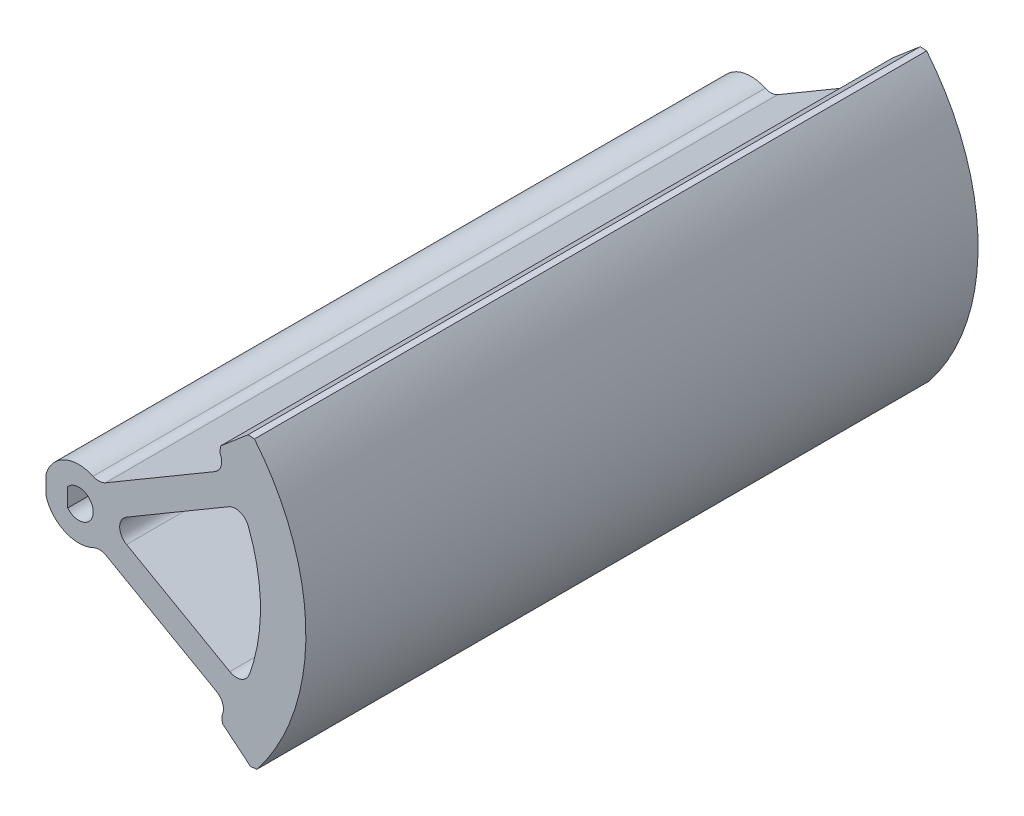
from build123d import *
from build123d.topology import SkipClean

# Parameters (mm, degrees)
BOSS_EXTRUDE1_DEPTH     = 74
CHAMFER1_SIZE           = 1
FILLET1_R               = 3
CUT_EXTRUDE1_DEPTH      = 121.138628729
CUT_EXTRUDE1_DEPTH_BACK = 121.138628729
CUT_EXTRUDE2_REACH      = 111.646
SKETCH4_R               = 1


with BuildPart() as part:
    # Sketch1 → Boss-Extrude1 (new, symmetric)
    with BuildSketch(Plane.XY):
        with BuildLine():
            Line((55.830466766, 51.361253738), (63.438083445, 57.851567172))
            ThreePointArc((63.438083445, 57.851567172), (72.243195979, 42.88470747), (75.398327752, 25.808934001))
            Line((75.398327752, 25.808934001), (65.398662212, 25.727147202))
            ThreePointArc((65.398662212, 25.727147202), (64.324262485, 34.614216947), (61.300381376, 43.039802177))
            Line((61.300381376, 43.039802177), (31.399799374, 25.449072083))
            Line((31.399799374, 25.449072083), (26.399966604, 25.408178684))
            ThreePointArc((26.399966604, 25.408178684), (25.395910676, 26.399991642), (24.40000005, 25.400000004))
            ThreePointArc((24.40000005, 25.400000004), (24.411675325, 25.24763781), (24.446428526, 25.098833357))
            Line((24.446428526, 25.098833357), (18.248213622, 23.141250154))
            ThreePointArc((18.248213622, 23.141250154), (17.987564613, 24.25728355), (17.90000005, 25.400000004))
            ThreePointArc((17.90000005, 25.400000004), (21.992343112, 32.081158151), (29.803433168, 31.471225314))
            Line((29.803433168, 31.471225314), (58.257984046, 48.211244769))
            ThreePointArc((58.257984046, 48.211244769), (57.083396924, 49.816436323), (55.830466766, 51.361253738))
        make_face()
    boss_extrude1 = extrude(amount=BOSS_EXTRUDE1_DEPTH, both=True)

    # Mirror1: Boss-Extrude1 across plane
    with SkipClean():  # the faces are left unmerged after this step: merging them gives an invalid solid
        add(boss_extrude1.mirror(Plane(origin=(-0.206032496, 25.190569454, 0), x_dir=(0, 0, 1), z_dir=(0.008178679945042752, -0.9999665540378622, 0))))

    # Chamfer1
    # the kernel refuses this chamfer: 1 mm, written as the material it takes off along each edge
    with BuildSketch(Plane(origin=(55.830466766, 51.361253738, -76.604800739), x_dir=(0.7607616678932755, 0.6490313433604278, 0), z_dir=(0, 0, 1))) as chamfer1_piece_1:
        with BuildLine():
            Line((CHAMFER1_SIZE, 0), (-0.01282473, -1.01282473))
            ThreePointArc((-0.01282473, -1.01282473), (-0.003390265, -0.520777989), (0, 0))
            Line((0, 0), (CHAMFER1_SIZE, 0))
        make_face()
    extrude(amount=153.209601479, mode=Mode.SUBTRACT)
    with BuildSketch(Plane(origin=(63.438083445, 57.851567172, 76.571682988), x_dir=(-0.7607616678932776, -0.6490313433604255, 0), z_dir=(0, 0, -1))) as chamfer1_piece_2:
        with BuildLine():
            Line((CHAMFER1_SIZE, 0), (0.009805807, -0.990194193))
            ThreePointArc((0.009805807, -0.990194193), (0.002592086, -0.509118755), (0, 0))
            Line((0, 0), (CHAMFER1_SIZE, 0))
        make_face()
    extrude(amount=153.143365976, mode=Mode.SUBTRACT)
    with BuildSketch(Plane(origin=(63.963798858, -6.425043932, 76.571682988), x_dir=(0.6288321665267481, 0.7775410640868277, 0), z_dir=(0, 0, -1))) as chamfer1_piece_3:
        with BuildLine():
            Line((0.990242745, 0), (CHAMFER1_SIZE * 0.00990242744899, -CHAMFER1_SIZE * 0.999950969763))
            Line((CHAMFER1_SIZE * 0.00990242744899, -CHAMFER1_SIZE * 0.999950969763), (0, 0))
            ThreePointArc((0, 0), (0.509119461, 0.002449552), (0.990242745, 0))
        make_face()
    extrude(amount=153.143365976, mode=Mode.SUBTRACT)
    with BuildSketch(Plane(origin=(56.251039097, -0.060035145, -76.604800739), x_dir=(0.6266844831673307, 0.7792730962616993, 0), z_dir=(0, 0, 1))) as chamfer1_piece_4:
        with BuildLine():
            Line((1.012905922, 0), (-CHAMFER1_SIZE * 0.0126613240298, -CHAMFER1_SIZE * 0.999919842224))
            Line((-CHAMFER1_SIZE * 0.0126613240298, -CHAMFER1_SIZE * 0.999919842224), (0, 0))
            ThreePointArc((0, 0), (0.520779169, -0.003203746), (1.012905922, 0))
        make_face()
    extrude(amount=153.209601479, mode=Mode.SUBTRACT)

    # Fillet1
    # the kernel refuses this fillet: 3 mm, written as the material it adds along each edge
    with BuildSketch(Plane(origin=(61.300381376, 43.039802177, 74), x_dir=(-0.8619070987590498, -0.5070662216207636, 0), z_dir=(0, 0, -1))) as fillet1_piece_1:
        with BuildLine():
            CenterArc((3.377068823, -3), FILLET1_R, 90, 99.332418184)
            Line((0.416776456, -3.486486486), (0.357570609, -3.496216216))
            ThreePointArc((0.357570609, -3.496216216), (0.110537283, -1.754940397), (-0.059831012, -0.0045))
            Line((-0.059831012, -0.0045), (0, 0.06))
            Line((0, 0.06), (3.377068823, 0.06))
            Line((3.377068823, 0.06), (3.377068823, 0))
        make_face()
    extrude(amount=148)
    with BuildSketch(Plane(origin=(31.399799374, 25.449072083, 74), x_dir=(0.861907098759051, 0.5070662216207618, 0), z_dir=(0, 0, -1))) as fillet1_piece_2:
        with BuildLine():
            CenterArc((FILLET1_R * 1.73205080757, FILLET1_R), FILLET1_R, 150, 120)
            Line((FILLET1_R * 0.866025403784, FILLET1_R * 1.5), (FILLET1_R * 0.848704895709, FILLET1_R * 1.51))
            Line((FILLET1_R * 0.848704895709, FILLET1_R * 1.51), (-FILLET1_R * 0.0346410161514, -FILLET1_R * 0.02))
            Line((-FILLET1_R * 0.0346410161514, -FILLET1_R * 0.02), (FILLET1_R * 1.73205080757, -FILLET1_R * 0.02))
            Line((FILLET1_R * 1.73205080757, -FILLET1_R * 0.02), (FILLET1_R * 1.73205080757, 0))
        make_face()
    extrude(amount=148)
    with BuildSketch(Plane(origin=(29.803433168, 31.471225314, -74), x_dir=(-0.8632427379298097, 0.5047890405025113, 0), z_dir=(0, 0, 1))) as fillet1_piece_3:
        with BuildLine():
            CenterArc((1.767704789, -2.985498375), FILLET1_R, 95.63586305, 55.150095421)
            Line((-0.850702684, -1.521277659), (-0.903070833, -1.491993244))
            Line((-0.903070833, -1.491993244), (-0.052368149, 0.029284414))
            Line((-0.052368149, 0.029284414), (0.005892349, 0.059709968))
            ThreePointArc((0.005892349, 0.059709968), (0.736543662, 0.023745938), (1.467194975, 0.059709968))
            Line((1.467194975, 0.059709968), (1.473087324, 0))
        make_face()
    extrude(amount=148)
    with BuildSketch(Plane(origin=(58.257984046, 48.211244769, -74), x_dir=(-0.6003331349359272, 0.7997500403863709, 0), z_dir=(0, 0, 1))) as fillet1_piece_4:
        with BuildLine():
            CenterArc((3.35394685, 2.974664865), FILLET1_R, 173.574848661, 88.973633867)
            Line((0.372790176, 3.310380343), (0.313167042, 3.317094653))
            Line((0.313167042, 3.317094653), (-0.059623133, 0.00671431))
            Line((-0.059623133, 0.00671431), (-0.002223664, -0.05995878))
            ThreePointArc((-0.002223664, -0.05995878), (1.482442617, -0.087479891), (2.957104003, -0.059493297))
            Line((2.957104003, -0.059493297), (2.964885235, 0))
        make_face()
    extrude(amount=148)
    with BuildSketch(Plane(origin=(61.584109507, 8.349773529, 74), x_dir=(-0.8700857787040926, 0.49290033241710485, 0), z_dir=(0, 0, -1))) as fillet1_piece_5:
        with BuildLine():
            CenterArc((3.377068823, 3), FILLET1_R, 170.667581816, 99.332418184)
            Line((0.416776456, 3.486486486), (0.357570609, 3.496216216))
            ThreePointArc((0.357570609, 3.496216216), (0.110537283, 1.754940397), (-0.059831012, 0.0045))
            Line((-0.059831012, 0.0045), (0, -0.06))
            Line((0, -0.06), (3.377068823, -0.06))
            Line((3.377068823, -0.06), (3.377068823, 0))
        make_face()
    extrude(amount=148)
    with BuildSketch(Plane(origin=(58.626707512, 3.129258857, -74), x_dir=(-0.870085778704093, 0.49290033241710457, 0), z_dir=(0, 0, 1))) as fillet1_piece_6:
        with BuildLine():
            CenterArc((3.331304629, 3), FILLET1_R, 181.026366133, 88.973633867)
            Line((0.331785955, 2.946262469), (0.271795581, 2.945187718))
            ThreePointArc((0.271795581, 2.945187718), (0.078962557, 1.482920686), (-0.059831012, 0.0045))
            Line((-0.059831012, 0.0045), (0, -0.06))
            Line((0, -0.06), (3.331304629, -0.06))
            Line((3.331304629, -0.06), (3.331304629, 0))
        make_face()
    extrude(amount=148)
    with BuildSketch(Plane(origin=(29.902149966, 19.401613043, -74), x_dir=(-0.8548705120852164, -0.5188414088786282, 0), z_dir=(0, 0, 1))) as fillet1_piece_7:
        with BuildLine():
            CenterArc((1.767704789, 2.985498375), FILLET1_R, 209.214041529, 55.150095421)
            Line((-0.850702684, 1.521277659), (-0.903070833, 1.491993244))
            Line((-0.903070833, 1.491993244), (-0.052368149, -0.029284414))
            Line((-0.052368149, -0.029284414), (0.005892349, -0.059709968))
            ThreePointArc((0.005892349, -0.059709968), (0.736543662, -0.023745938), (1.467194975, -0.059709968))
            Line((1.467194975, -0.059709968), (1.473087324, 0))
        make_face()
    extrude(amount=148)

    # Sketch3 → Cut-Extrude1 (cut, two sides: drawn at the far end of the back side and taken through both)
    with BuildSketch(Plane.XY.offset(-CUT_EXTRUDE1_DEPTH_BACK)):
        with BuildLine():
            Line((22.960409716, 23.368000004), (22.960409716, 27.432000004))
            ThreePointArc((22.960409716, 27.432000004), (28.57500005, 25.400000004), (22.960409716, 23.368000004))
        make_face()
        with BuildLine():
            Line((18.180514196, 27.432000004), (18.180514196, 23.368000004))
            ThreePointArc((18.180514196, 23.368000004), (17.90000005, 25.400000004), (18.180514196, 27.432000004))
        make_face()
    extrude(amount=CUT_EXTRUDE1_DEPTH + CUT_EXTRUDE1_DEPTH_BACK, mode=Mode.SUBTRACT)

    # Sketch4 → Cut-Extrude2 (cut, up to next)
    with BuildSketch(Plane.ZY.offset(-18.180514196), mode=Mode.PRIVATE) as cut_extrude2_sk1:
        with Locations((0, 25.400000004)):
            Circle(SKETCH4_R)
    cut_extrude2_tool1 = extrude(cut_extrude2_sk1.sketch, amount=-CUT_EXTRUDE2_REACH, mode=Mode.PRIVATE) & part.part
    # Sketch4 → Cut-Extrude2 (cut, up to next)
    with BuildSketch(Plane.ZY.offset(-18.180514196), mode=Mode.PRIVATE) as cut_extrude2_sk2:
        with Locations((30, 25.400000004)):
            Circle(SKETCH4_R)
    cut_extrude2_tool2 = extrude(cut_extrude2_sk2.sketch, amount=-CUT_EXTRUDE2_REACH, mode=Mode.PRIVATE) & part.part
    # Sketch4 → Cut-Extrude2 (cut, up to next)
    with BuildSketch(Plane.ZY.offset(-18.180514196), mode=Mode.PRIVATE) as cut_extrude2_sk3:
        with Locations((60, 25.400000004)):
            Circle(SKETCH4_R)
    cut_extrude2_tool3 = extrude(cut_extrude2_sk3.sketch, amount=-CUT_EXTRUDE2_REACH, mode=Mode.PRIVATE) & part.part
    # Sketch4 → Cut-Extrude2 (cut, up to next)
    with BuildSketch(Plane.ZY.offset(-18.180514196), mode=Mode.PRIVATE) as cut_extrude2_sk4:
        with Locations((-30, 25.400000004)):
            Circle(SKETCH4_R)
    cut_extrude2_tool4 = extrude(cut_extrude2_sk4.sketch, amount=-CUT_EXTRUDE2_REACH, mode=Mode.PRIVATE) & part.part
    # Sketch4 → Cut-Extrude2 (cut, up to next)
    with BuildSketch(Plane.ZY.offset(-18.180514196), mode=Mode.PRIVATE) as cut_extrude2_sk5:
        with Locations((-60, 25.400000004)):
            Circle(SKETCH4_R)
    cut_extrude2_tool5 = extrude(cut_extrude2_sk5.sketch, amount=-CUT_EXTRUDE2_REACH, mode=Mode.PRIVATE) & part.part
    add(cut_extrude2_tool1.solids().sort_by_distance((18.180514, 25.4, 0))[0], mode=Mode.SUBTRACT)
    add(cut_extrude2_tool2.solids().sort_by_distance((18.180514, 25.4, 30))[0], mode=Mode.SUBTRACT)
    add(cut_extrude2_tool3.solids().sort_by_distance((18.180514, 25.4, 60))[0], mode=Mode.SUBTRACT)
    add(cut_extrude2_tool4.solids().sort_by_distance((18.180514, 25.4, -30))[0], mode=Mode.SUBTRACT)
    add(cut_extrude2_tool5.solids().sort_by_distance((18.180514, 25.4, -60))[0], mode=Mode.SUBTRACT)


solid = part.part
